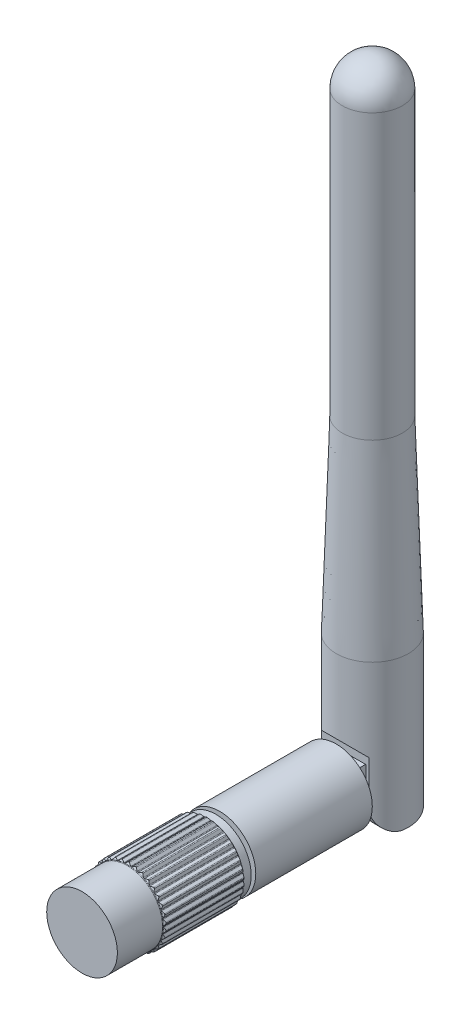
from build123d import *

# Parameters (mm, degrees)
SKETCH2_W                      = 5.5
SKETCH2_H                      = 7.8
CUT_EXTRUDE1_DEPTH             = 8
CUT_EXTRUDE2_REACH             = 88.965
CUT_EXTRUDE2_DIRECTION_2_REACH = 88.965
BOSS_EXTRUDE1_START            = 0.35
BOSS_EXTRUDE1_DEPTH            = 4.8
SKETCH5_R                      = 4.8
BOSS_EXTRUDE2_DEPTH            = 15.5
SKETCH6_R                      = 3.5
BOSS_EXTRUDE3_DEPTH            = 0.5
SKETCH7_R                      = 4.7
BOSS_EXTRUDE4_DEPTH            = 17.8
BOSS_EXTRUDE5_START            = -6
BOSS_EXTRUDE5_DEPTH            = 10.8
CIRPATTERN1_COUNT              = 34


with BuildPart() as part:
    # Sketch1 → Revolve1 (revolve)
    with BuildSketch(Plane(origin=(0, 0, 0), x_dir=(0, 0, -1), z_dir=(1, 0, 0))):
        with BuildLine():
            Line((0, 0), (4.8, 0))
            Line((4.8, 0), (4.8, 20))
            Line((4.8, 20), (4, 45))
            Line((4, 45), (4, 82.7))
            ThreePointArc((4, 82.7), (2.828427125, 85.528427125), (0, 86.7))
            Line((0, 86.7), (0, 0))
        make_face()
    revolve(axis=Axis((0, 0, 0), (0, 1, 0)))

    # Sketch2 → Cut-Extrude1 (cut)
    with BuildSketch(Plane.XZ):
        with Locations((0, 0.9)):
            Rectangle(SKETCH2_W, SKETCH2_H)
    extrude(amount=-CUT_EXTRUDE1_DEPTH, mode=Mode.SUBTRACT)

    # Sketch4 → Cut-Extrude2 (cut, up to next)
    with BuildSketch(Plane(origin=(0, 0, 0), x_dir=(0, 0, -1), z_dir=(1, 0, 0)), mode=Mode.PRIVATE) as cut_extrude2_sk1:
        with BuildLine():
            Line((-4.8, 10.2), (-3.6, 9))
            Line((-3.6, 9), (-3.6, 3))
            ThreePointArc((-3.6, 3), (-2.721320344, 0.878679656), (-0.6, 0))
            Line((-0.6, 0), (-4.8, 0))
            Line((-4.8, 0), (-4.8, 10.2))
        make_face()
    cut_extrude2_tool1 = extrude(cut_extrude2_sk1.sketch, amount=-CUT_EXTRUDE2_REACH, mode=Mode.PRIVATE) & part.part
    add(cut_extrude2_tool1.solids().sort_by_distance((0, 4.212363, 4.028338))[0], mode=Mode.SUBTRACT)

    # Sketch4 → Cut-Extrude2 direction 2 (cut, up to next)
    with BuildSketch(Plane(origin=(0, 0, 0), x_dir=(0, 0, -1), z_dir=(1, 0, 0)), mode=Mode.PRIVATE) as cut_extrude2_direction_2_sk1:
        with BuildLine():
            Line((-4.8, 10.2), (-3.6, 9))
            Line((-3.6, 9), (-3.6, 3))
            ThreePointArc((-3.6, 3), (-2.721320344, 0.878679656), (-0.6, 0))
            Line((-0.6, 0), (-4.8, 0))
            Line((-4.8, 0), (-4.8, 10.2))
        make_face()
    cut_extrude2_direction_2_tool1 = extrude(cut_extrude2_direction_2_sk1.sketch, amount=CUT_EXTRUDE2_DIRECTION_2_REACH, mode=Mode.PRIVATE) & part.part
    add(cut_extrude2_direction_2_tool1.solids().sort_by_distance((0, 4.212363, 4.028338))[0], mode=Mode.SUBTRACT)


with BuildPart() as body_2:
    # Sketch3 → Boss-Extrude1 (new body)
    with BuildSketch(Plane(origin=(-2.75, 0, 0), x_dir=(0, 0, -1), z_dir=(1, 0, 0)).offset(BOSS_EXTRUDE1_START)):
        with BuildLine():
            Line((-4.8, 7.7), (-4.8, 1.9))
            Line((-4.8, 1.9), (0, 1.9))
            ThreePointArc((0, 1.9), (2.9, 4.8), (0, 7.7))
            Line((0, 7.7), (-4.8, 7.7))
        make_face()
    extrude(amount=BOSS_EXTRUDE1_DEPTH)

    # Sketch5 → Boss-Extrude2 (add)
    with BuildSketch(Plane.XY.offset(4.8)):
        with Locations((0, 4.8)):
            Circle(SKETCH5_R)
    extrude(amount=BOSS_EXTRUDE2_DEPTH)

    # Sketch6 → Boss-Extrude3 (add)
    with BuildSketch(Plane.XY.offset(20.3)):
        with Locations((0, 4.8)):
            Circle(SKETCH6_R)
    extrude(amount=BOSS_EXTRUDE3_DEPTH)

    # Sketch7 → Boss-Extrude4 (add)
    with BuildSketch(Plane.XY.offset(20.8)):
        with Locations((0, 4.8)):
            Circle(SKETCH7_R)
    extrude(amount=BOSS_EXTRUDE4_DEPTH)

    # Sketch8 → Boss-Extrude5 (add)
    with BuildSketch(Plane.XY.offset(38.6).offset(BOSS_EXTRUDE5_START)):
        with BuildLine():
            Line((-0.433661289, 0.120049371), (-0.438274707, 0.070262663))
            ThreePointArc((-0.438274707, 0.070262663), (-0.400135005, 0.064040354), (-0.365950586, 0.046018715))
            Line((-0.365950586, 0.046018715), (-0.072324121, -0.175756052))
            ThreePointArc((-0.072324121, -0.175756052), (0, -0.2), (0.072324121, -0.175756052))
            Line((0.072324121, -0.175756052), (0.365950586, 0.046018715))
            ThreePointArc((0.365950586, 0.046018715), (0.400135005, 0.064040354), (0.438274707, 0.070262663))
            Line((0.438274707, 0.070262663), (0.433661289, 0.120049371))
            Line((0.433661289, 0.120049371), (-0.433661289, 0.120049371))
        make_face()
    boss_extrude5 = extrude(amount=-BOSS_EXTRUDE5_DEPTH)

    # CirPattern1: Boss-Extrude5 ×34 about axis
    cirpattern1_axis = Axis((0, 4.8, 38.6), (0, 0, 1))
    for i in range(1, CIRPATTERN1_COUNT):
        add(boss_extrude5.rotate(cirpattern1_axis, i * 360 / CIRPATTERN1_COUNT))

    # Sketch9 → Cut-Revolve1 (revolve, cut)
    with BuildSketch(Plane(origin=(0, 0, 0), x_dir=(0, 0, -1), z_dir=(1, 0, 0))):
        with BuildLine():
            Line((-32.51339746, 9.55), (-32.397927406, 9.75))
            ThreePointArc((-32.397927406, 9.75), (-32.361324865, 9.78660254), (-32.311324865, 9.8))
            Line((-32.311324865, 9.8), (-32.6, 9.8))
            Line((-32.6, 9.8), (-32.6, 9.5))
            ThreePointArc((-32.6, 9.5), (-32.55, 9.51339746), (-32.51339746, 9.55))
        make_face()
        with BuildLine():
            Line((-21.88660254, 9.55), (-22.002072594, 9.75))
            ThreePointArc((-22.002072594, 9.75), (-22.038675135, 9.78660254), (-22.088675135, 9.8))
            Line((-22.088675135, 9.8), (-21.8, 9.8))
            Line((-21.8, 9.8), (-21.8, 9.5))
            ThreePointArc((-21.8, 9.5), (-21.85, 9.51339746), (-21.88660254, 9.55))
        make_face()
    revolve(axis=Axis((0, 4.8, 20.8), (0, 0, 1)), mode=Mode.SUBTRACT)


solid = Compound([part.part, body_2.part])
